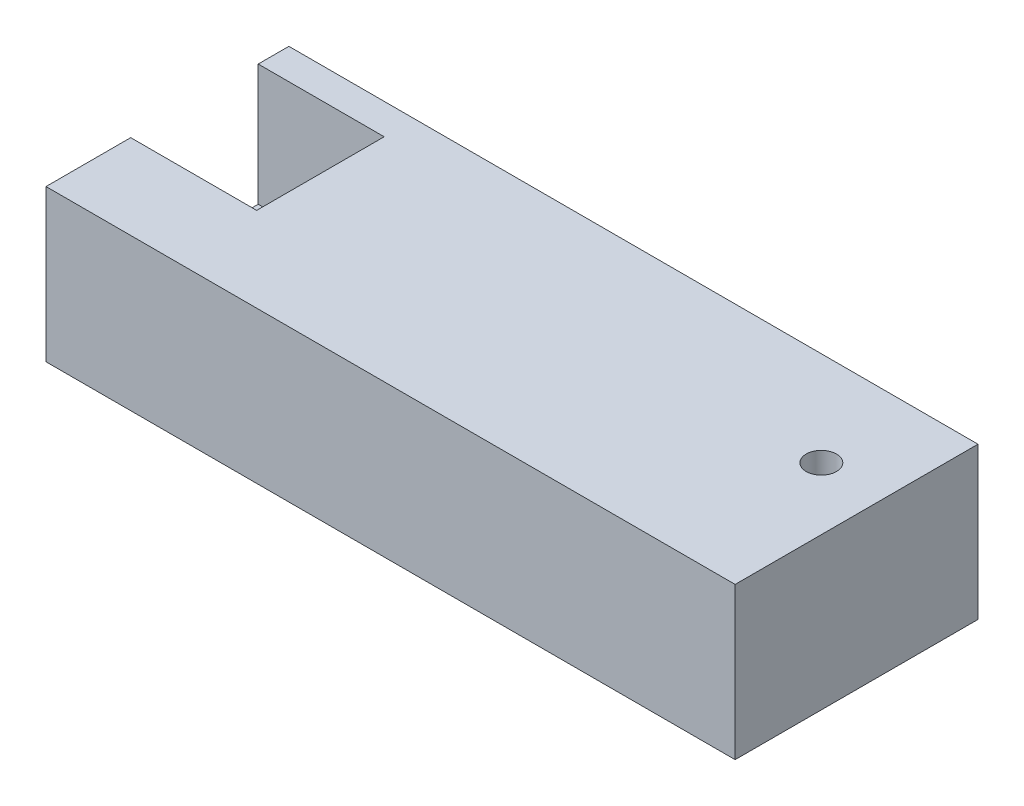
from build123d import *

# Parameters (mm, degrees)
SKETCH1_W           = 227
SKETCH1_H           = 80
SKETCH1_R           = 5
BOSS_EXTRUDE1_DEPTH = 50
SKETCH2_W           = 42
SKETCH2_H           = 42
CUT_EXTRUDE1_DEPTH  = 40


with BuildPart() as part:
    # Sketch1 → Boss-Extrude1 (new body)
    with BuildSketch(Plane(origin=(0, 0, 0), x_dir=(1, 0, 0), z_dir=(0, 1, 0))):
        Rectangle(SKETCH1_W, SKETCH1_H)
        with Locations((-93, 8.9)):
            Circle(SKETCH1_R, mode=Mode.SUBTRACT)
        with Locations((93, 8.9)):
            Circle(SKETCH1_R, mode=Mode.SUBTRACT)
    extrude(amount=BOSS_EXTRUDE1_DEPTH)

    # Sketch2 → Cut-Extrude1 (cut)
    with BuildSketch(Plane(origin=(0, 50, 0), x_dir=(1, 0, 0), z_dir=(0, 1, 0))):
        with Locations((-93, 8.9)):
            Rectangle(SKETCH2_W, SKETCH2_H)
    extrude(amount=-CUT_EXTRUDE1_DEPTH, mode=Mode.SUBTRACT)


solid = part.part
